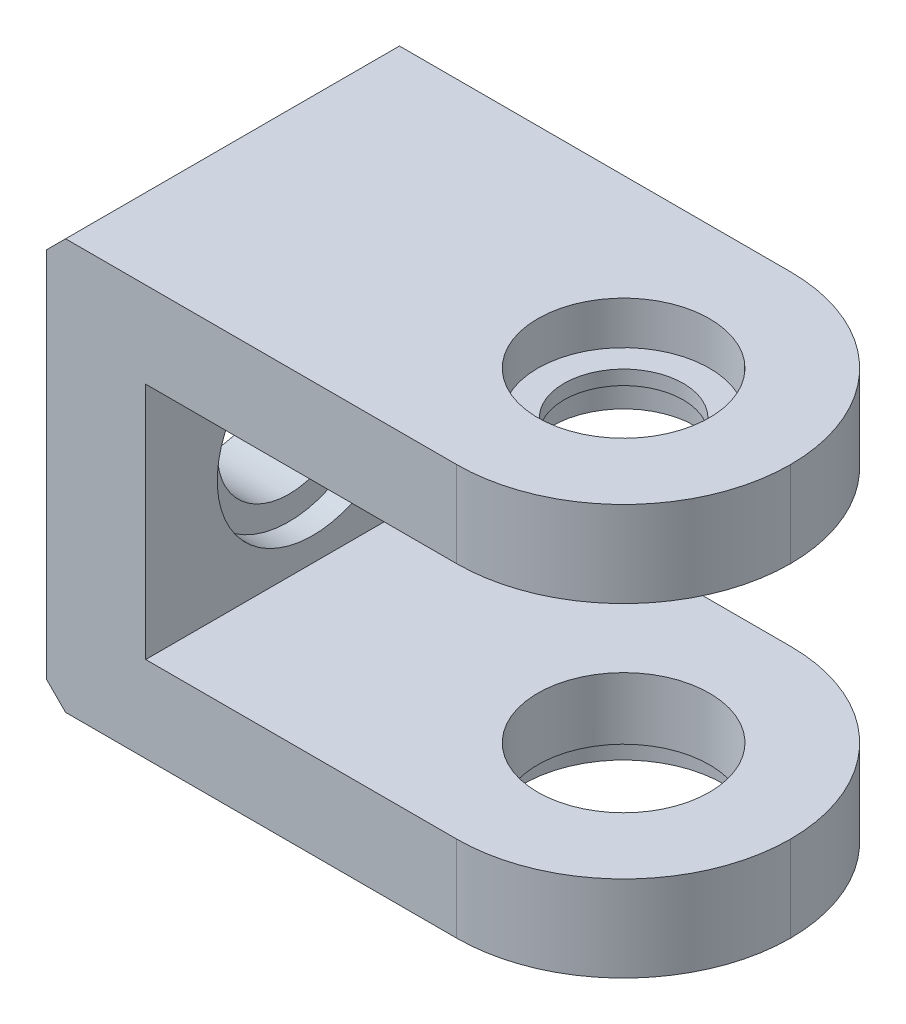
from build123d import *

# Parameters (mm, degrees)
P_IDAT_VYSUNUT_M1_DEPTH  = 70
ZAOBLIT1_R               = 35
ODEBRAT_VYSUNUT_M2_REACH = 166.125
SKICA3_R                 = 15
SKICA5_R                 = 20
ODEBRAT_VYSUNUT_M3_DEPTH = 5
ODEBRAT_VYSUNUT_M4_REACH = 166.125
SKICA6_R                 = 12.5
SKICA7_R                 = 18
ODEBRAT_VYSUNUT_M5_DEPTH = 9
SKICA8_R                 = 15
ODEBRAT_VYSUNUT_M6_DEPTH = 6
ODEBRAT_VYSUNUT_M7_REACH = 166.125
SKICA9_R                 = 18
SKICA10_R                = 21
ODEBRAT_VYSUNUT_M8_DEPTH = 5
ZKOSEN_1_SIZE            = 4


with BuildPart() as part:
    # Skica2 → Přidat vysunutím1 (new body)
    with BuildSketch(Plane.XY):
        Polygon((0, 0), (-121, 0), (-121, -86), (0, -86), (0, -68), (-100.200761753, -68), (-100.200761753, -18), (0, -18), align=None)
    extrude(amount=P_IDAT_VYSUNUT_M1_DEPTH)

    # Zaoblit1
    zaoblit1_edges = [part.edges().sort_by_distance(p)[0] for p in [
        (0, -77, 70),
        (0, -77, 0),
        (0, -9, 70),
        (0, -9, 0),
    ]]
    fillet(zaoblit1_edges, radius=ZAOBLIT1_R - 0.0001)  # a hair under: the kernel refuses the full size

    # Skica3 → Odebrat vysunutím2 (cut, up to next)
    with BuildSketch(Plane.ZY.offset(121), mode=Mode.PRIVATE) as odebrat_vysunut_m2_sk1:
        with Locations((35, -43)):
            Circle(SKICA3_R)
    odebrat_vysunut_m2_tool1 = extrude(odebrat_vysunut_m2_sk1.sketch, amount=-ODEBRAT_VYSUNUT_M2_REACH, mode=Mode.PRIVATE) & part.part
    add(odebrat_vysunut_m2_tool1.solids().sort_by_distance((-121, -43, 35))[0], mode=Mode.SUBTRACT)

    # Skica5 → Odebrat vysunutím3 (cut)
    with BuildSketch(Plane(origin=(-100.200761753, 0, 0), x_dir=(0, 0, -1), z_dir=(1, 0, 0))):
        with Locations((-35, -43)):
            Circle(SKICA5_R)
    extrude(amount=-ODEBRAT_VYSUNUT_M3_DEPTH, mode=Mode.SUBTRACT)

    # Skica6 → Odebrat vysunutím4 (cut, up to next)
    with BuildSketch(Plane(origin=(0, 0, 0), x_dir=(1, 0, 0), z_dir=(0, 1, 0)), mode=Mode.PRIVATE) as odebrat_vysunut_m4_sk1:
        with Locations(Location((-35, -35, 0), (0, 0, 180))):
            Circle(SKICA6_R)
    odebrat_vysunut_m4_tool1 = extrude(odebrat_vysunut_m4_sk1.sketch, amount=-ODEBRAT_VYSUNUT_M4_REACH, mode=Mode.PRIVATE) & part.part
    add(odebrat_vysunut_m4_tool1.solids().sort_by_distance((-35, 0, 35))[0], mode=Mode.SUBTRACT)

    # Skica7 → Odebrat vysunutím5 (cut)
    with BuildSketch(Plane(origin=(0, 0, 0), x_dir=(1, 0, 0), z_dir=(0, 1, 0))):
        with Locations(Location((-35, -35, 0), (0, 0, 180))):
            Circle(SKICA7_R)
    extrude(amount=-ODEBRAT_VYSUNUT_M5_DEPTH, mode=Mode.SUBTRACT)

    # Skica8 → Odebrat vysunutím6 (cut)
    with BuildSketch(Plane.XZ.offset(18)):
        with Locations(Location((-35, 35, 0), (0, 0, 270))):
            Circle(SKICA8_R)
    extrude(amount=-ODEBRAT_VYSUNUT_M6_DEPTH, mode=Mode.SUBTRACT)

    # Skica9 → Odebrat vysunutím7 (cut, up to next)
    with BuildSketch(Plane.XZ.offset(86), mode=Mode.PRIVATE) as odebrat_vysunut_m7_sk1:
        with Locations(Location((-35, 35, 0), (0, 0, 180))):
            Circle(SKICA9_R)
    odebrat_vysunut_m7_tool1 = extrude(odebrat_vysunut_m7_sk1.sketch, amount=-ODEBRAT_VYSUNUT_M7_REACH, mode=Mode.PRIVATE) & part.part
    add(odebrat_vysunut_m7_tool1.solids().sort_by_distance((-35, -86, 35))[0], mode=Mode.SUBTRACT)

    # Skica10 → Odebrat vysunutím8 (cut)
    with BuildSketch(Plane.XZ.offset(86)):
        with Locations((-35, 35)):
            Circle(SKICA10_R)
    extrude(amount=-ODEBRAT_VYSUNUT_M8_DEPTH, mode=Mode.SUBTRACT)

    # Zkosení1
    zkosen_1_edges = [part.edges().sort_by_distance(p)[0] for p in [
        (-121, -86, 35),
        (-121, 0, 35),
    ]]
    chamfer(zkosen_1_edges, length=ZKOSEN_1_SIZE)


solid = part.part
